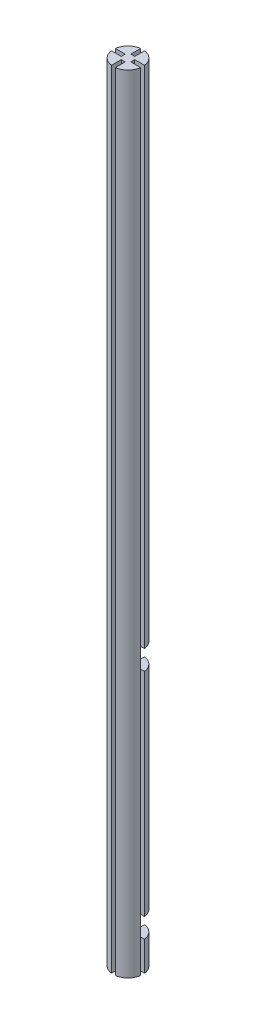
from build123d import *

# Parameters (mm, degrees)
BOSS_EXTRUDE2_DEPTH = 4000
CUT_EXTRUDE1_START  = 200
SKETCH2_W           = 74.330343737
SKETCH2_H           = 74.330343737
CUT_EXTRUDE1_DEPTH  = 50
CUT_EXTRUDE2_START  = 1380
SKETCH2_2_W         = 74.330343737
SKETCH2_2_H         = 74.330343737
CUT_EXTRUDE2_DEPTH  = 50


with BuildPart() as part:
    # Sketch1 → Boss-Extrude2 (new body)
    with BuildSketch(Plane(origin=(0, 0, 0), x_dir=(1, 0, 0), z_dir=(0, 1, 0))):
        with BuildLine():
            Line((-10, 74.330343737), (-10, 24.330343737))
            Line((-10, 24.330343737), (10, 24.330343737))
            Line((10, 24.330343737), (10, 74.330343737))
            ThreePointArc((10, 74.330343737), (53.033008589, 53.033008589), (74.330343737, 10))
            Line((74.330343737, 10), (24.330343737, 10))
            Line((24.330343737, 10), (24.330343737, -10))
            Line((24.330343737, -10), (74.330343737, -10))
            ThreePointArc((74.330343737, -10), (53.033008589, -53.033008589), (10, -74.330343737))
            Line((10, -74.330343737), (10, -24.330343737))
            Line((10, -24.330343737), (-10, -24.330343737))
            Line((-10, -24.330343737), (-10, -74.330343737))
            ThreePointArc((-10, -74.330343737), (-53.033008589, -53.033008589), (-74.330343737, -10))
            Line((-74.330343737, -10), (-24.330343737, -10))
            Line((-24.330343737, -10), (-24.330343737, 10))
            Line((-24.330343737, 10), (-74.330343737, 10))
            ThreePointArc((-74.330343737, 10), (-53.033008589, 53.033008589), (-10, 74.330343737))
        make_face()
    extrude(amount=BOSS_EXTRUDE2_DEPTH)

    # Sketch2 → Cut-Extrude1 (cut, symmetric)
    with BuildSketch(Plane(origin=(0, 0, 0), x_dir=(1, 0, 0), z_dir=(0, 1, 0)).offset(CUT_EXTRUDE1_START)):
        with Locations((37.165171869, 37.165171869)):
            Rectangle(SKETCH2_W, SKETCH2_H)
    extrude(amount=CUT_EXTRUDE1_DEPTH, both=True, mode=Mode.SUBTRACT)

    # Sketch2<2> → Cut-Extrude2 (cut, symmetric)
    with BuildSketch(Plane(origin=(0, 0, 0), x_dir=(1, 0, 0), z_dir=(0, 1, 0)).offset(CUT_EXTRUDE2_START)):
        with Locations((37.165171869, 37.165171869)):
            Rectangle(SKETCH2_2_W, SKETCH2_2_H)
    extrude(amount=CUT_EXTRUDE2_DEPTH, both=True, mode=Mode.SUBTRACT)


solid = part.part
